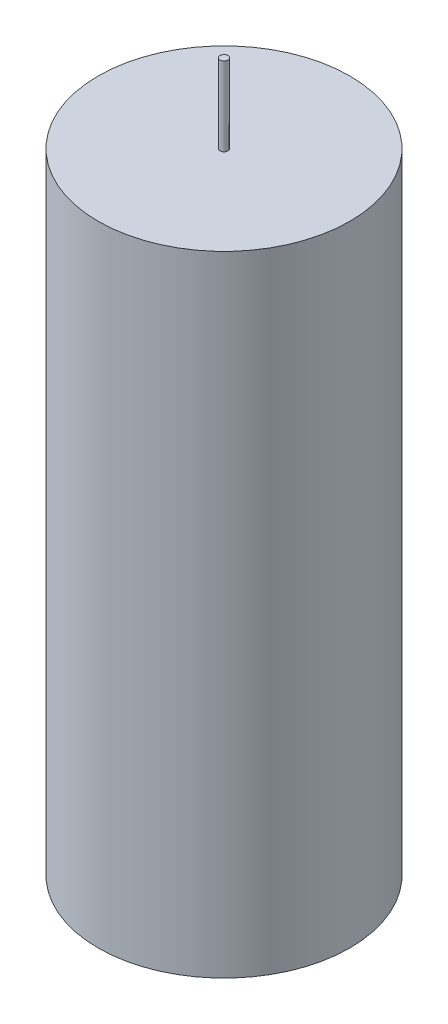
from build123d import *


with BuildPart() as part:
    # Croquis1 → Revolución1 (revolve)
    with BuildSketch(Plane.XY):
        Polygon((2.5, 250), (0, 250), (0, -250), (2.5, -250), (2.5, -200), (80, -200), (80, 200), (2.5, 200), align=None)
    revolve(axis=Axis((0, 415.25313391, 0), (0, -1, 0)))


solid = part.part
